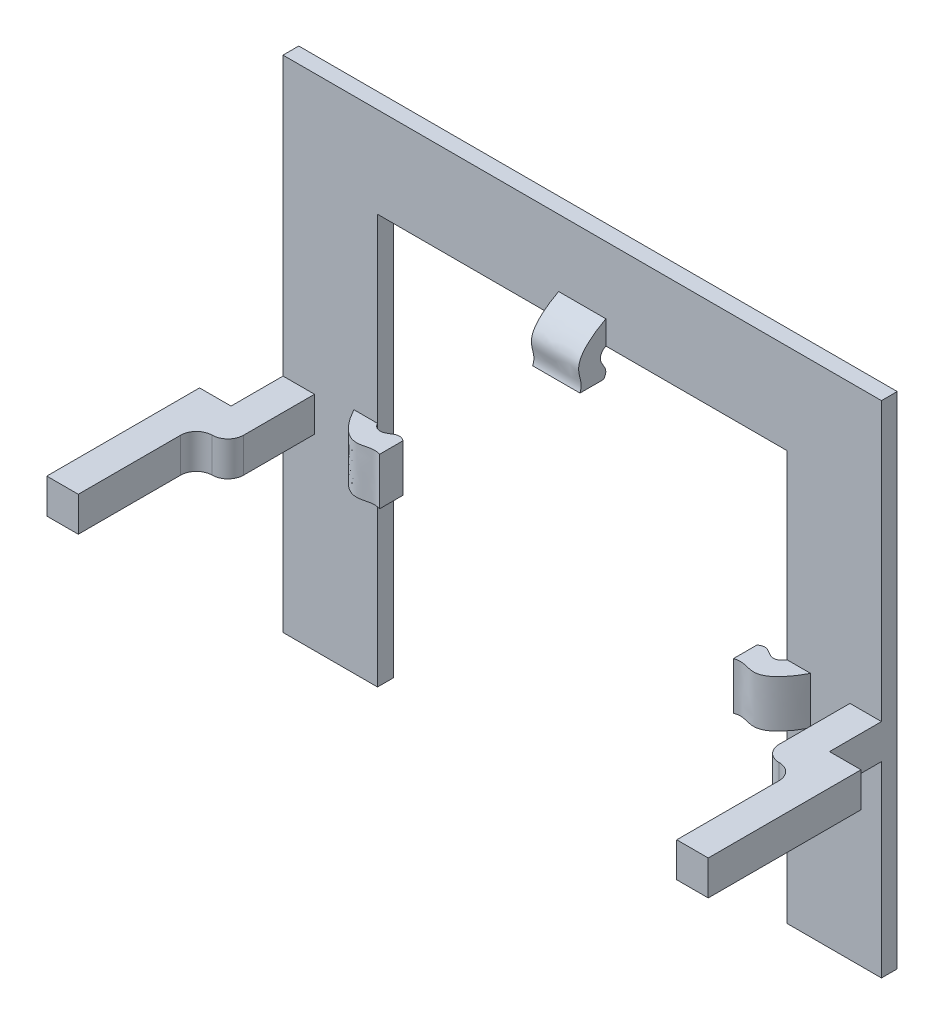
from build123d import *

# Parameters (mm, degrees)
BOSS_EXTRUDE1_DEPTH      = 1
BOSS_EXTRUDE2_START      = -1.5
BOSS_EXTRUDE2_DEPTH      = 3
CIRPATTERN1_COUNT        = 3
CIRPATTERN1_ANGLE        = 180
SKETCH4_W                = 2
SKETCH4_H                = 2.2
BOSS_EXTRUDE3_DEPTH      = 5.5
BOSS_EXTRUDE4_DEPTH      = 7.5
BOSS_EXTRUDE4_DEPTH_BACK = 2.2
SKETCH5_W                = 2
SKETCH5_H                = 2.2
FILLET1_START            = -30
FILLET1_DEPTH            = 4
FILLET1_START_2          = -29.415
FILLET1_2_DEPTH          = 2.2


with BuildPart() as part:
    # Sketch1 → Boss-Extrude1 (new body)
    with BuildSketch(Plane.XY):
        Polygon((13, -9.565), (-13, -9.565), (-19, -9.565), (-19, -41.315), (-13, -41.315), (-13, -15.315), (13, -15.315), (13, -41.315), (19, -41.315), (19, -9.565), align=None)
    extrude(amount=BOSS_EXTRUDE1_DEPTH)

    # Boss-Extrude2: read off the stored shape, not the designer's step
    # Boss-Extrude2 outline → Boss-Extrude2 (add)
    with BuildSketch(Plane(origin=(0, -28.315, 0), x_dir=(-1, 0, 0), z_dir=(0, -1, 0)).offset(BOSS_EXTRUDE2_START)):
        with BuildLine():
            Line((-11.23522271, -2.644286359), (-11.23522271, -1.144286359))
            add(Edge.make_bspline(
                [(-11.23522271, -1.144286359), (-11.740174878, -0.757764956), (-12.028679887, -1.161534837), (-12.227869222, -1.503002268), (-12.747184273, -1.488774458), (-13, -1)],
                knots=[0, 0, 0, 0, 0, 0, 1, 1, 1, 1, 1, 1], degree=5))
            Line((-13, -1), (-14.5, -1))
            add(Edge.make_bspline(
                [(-14.5, -1), (-13.760887065, -2.414906572), (-12.67824158, -3.40768712), (-12.345095428, -2.525951835), (-11.7215069, -2.450856602), (-11.23522271, -2.644286359)],
                knots=[0, 0, 0, 0, 0, 0, 1, 1, 1, 1, 1, 1], degree=5))
        make_face()
    boss_extrude2 = extrude(amount=BOSS_EXTRUDE2_DEPTH)

    # CirPattern1: Boss-Extrude2 ×3 about axis
    cirpattern1_axis = Axis((0, -28.315, 1.05), (0, 0, 1))
    for i in range(1, CIRPATTERN1_COUNT):
        add(boss_extrude2.rotate(cirpattern1_axis, i * CIRPATTERN1_ANGLE / (CIRPATTERN1_COUNT - 1)))

    # Sketch4 → Boss-Extrude3 (add)
    with BuildSketch(Plane.XY.offset(1)):
        with Locations((-18, -28.315)):
            Rectangle(SKETCH4_W, SKETCH4_H)
        with Locations((18, -28.315)):
            Rectangle(SKETCH4_W, SKETCH4_H)
    extrude(amount=BOSS_EXTRUDE3_DEPTH)

    # Sketch5 → Boss-Extrude4 (add, two sides: drawn at the far end of the back side and taken through both)
    with BuildSketch(Plane.XY.offset(6.5).offset(-BOSS_EXTRUDE4_DEPTH_BACK)):
        with Locations((-20, -28.315)):
            Rectangle(SKETCH5_W, SKETCH5_H)
        with Locations((20, -28.315)):
            Rectangle(SKETCH5_W, SKETCH5_H)
    extrude(amount=BOSS_EXTRUDE4_DEPTH + BOSS_EXTRUDE4_DEPTH_BACK)

    # Fillet1: read off the stored shape, not the designer's step
    # Fillet1 outline → Fillet1 (cut)
    with BuildSketch(Plane(origin=(0, 0, 0), x_dir=(1, 0, 0), z_dir=(0, 1, 0)).offset(FILLET1_START)):
        with BuildLine():
            Line((17, -6.5), (18, -6.5))
            ThreePointArc((18, -6.5), (17.292893219, -6.207106781), (17, -5.5))
            Line((17, -5.5), (17, -6.5))
        make_face()
        with BuildLine():
            ThreePointArc((-17, -5.5), (-17.292893219, -6.207106781), (-18, -6.5))
            Line((-18, -6.5), (-17, -6.5))
            Line((-17, -6.5), (-17, -5.5))
        make_face()
    extrude(amount=FILLET1_DEPTH, mode=Mode.SUBTRACT)

    # Fillet1 2 outline → Fillet1 2 (add)
    with BuildSketch(Plane(origin=(0, 0, 0), x_dir=(1, 0, 0), z_dir=(0, 1, 0)).offset(FILLET1_START_2)):
        with BuildLine():
            Line((19, -6.5), (18, -6.5))
            ThreePointArc((18, -6.5), (18.707106781, -6.792893219), (19, -7.5))
            Line((19, -7.5), (19, -6.5))
        make_face()
        with BuildLine():
            ThreePointArc((-19, -7.5), (-18.707106781, -6.792893219), (-18, -6.5))
            Line((-18, -6.5), (-19, -6.5))
            Line((-19, -6.5), (-19, -7.5))
        make_face()
    extrude(amount=FILLET1_2_DEPTH)


solid = part.part
